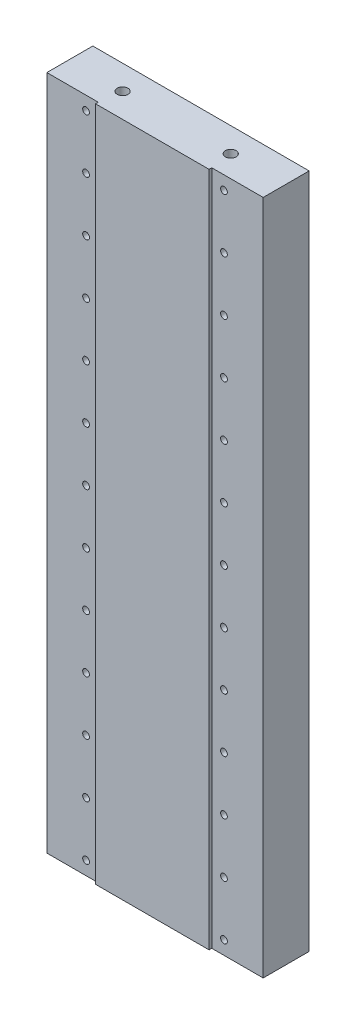
from build123d import *

# Parameters (mm, degrees)
CROQUIS1_W                         = 80
CROQUIS1_H                         = 250
SALIENTE_EXTRUIR1_DEPTH            = 18
CROQUIS2_W                         = 19
CROQUIS2_H                         = 250
CORTAR_EXTRUIR1_DEPTH              = 1
MATRIZL1_COUNT                     = 13
MATRIZL1_PITCH                     = 20
MATRIZL1_COUNT_DIR2                = 2
MATRIZL1_PITCH_DIR2                = 51
TALADROS_DE_ESPIGA_DE_4_0MM1_D     = 4
TALADROS_DE_ESPIGA_DE_4_0MM1_DEPTH = 12
TALADROS_DE_ESPIGA_DE_4_0MM1_TIP   = 1.201721238


with BuildPart() as part:
    # Croquis1 → Saliente-Extruir1 (new body)
    with BuildSketch(Plane.XY):
        with Locations((40, 125)):
            Rectangle(CROQUIS1_W, CROQUIS1_H)
    extrude(amount=SALIENTE_EXTRUIR1_DEPTH)

    # Croquis2 → Cortar-Extruir1 (cut)
    with BuildSketch(Plane.XY.offset(18)):
        with Locations((9.5, 125)):
            Rectangle(CROQUIS2_W, CROQUIS2_H)
        with Locations((70.5, 125)):
            Rectangle(CROQUIS2_W, CROQUIS2_H)
    extrude(amount=-CORTAR_EXTRUIR1_DEPTH, mode=Mode.SUBTRACT)

    # Croquis4 → Taladro roscado M31 (revolve, cut)
    with BuildSketch(Plane(origin=(14.5, 245, 17), x_dir=(0, -1, 0), z_dir=(1, 0, 0))):
        Polygon((0, 0), (0, 10.751075774), (1.25, 10), (1.25, 0), align=None)
    taladro_roscado_m31 = revolve(axis=Axis((14.5, 245, 23.35), (0, 0, -1)), mode=Mode.SUBTRACT)

    # MatrizL1: Taladro roscado M31 13 × 2
    with Locations(*[(j * MATRIZL1_PITCH_DIR2, -i * MATRIZL1_PITCH, 0) for i in range(MATRIZL1_COUNT) for j in range(MATRIZL1_COUNT_DIR2) if (i, j) != (0, 0)]):
        add(taladro_roscado_m31, mode=Mode.SUBTRACT)

    # Taladros de espiga de Ø4.0mm1
    with Locations(Plane(origin=(0, 250, 0), x_dir=(1, 0, 0), z_dir=(0, 1, 0))):
        with Locations((60, -9), (20, -9)):
            Hole(TALADROS_DE_ESPIGA_DE_4_0MM1_D / 2, depth=TALADROS_DE_ESPIGA_DE_4_0MM1_DEPTH)
            with Locations((0, 0, -(TALADROS_DE_ESPIGA_DE_4_0MM1_DEPTH + TALADROS_DE_ESPIGA_DE_4_0MM1_TIP / 2))):  # 118° drill point
                Cone(0, TALADROS_DE_ESPIGA_DE_4_0MM1_D / 2, TALADROS_DE_ESPIGA_DE_4_0MM1_TIP, mode=Mode.SUBTRACT)


solid = part.part
